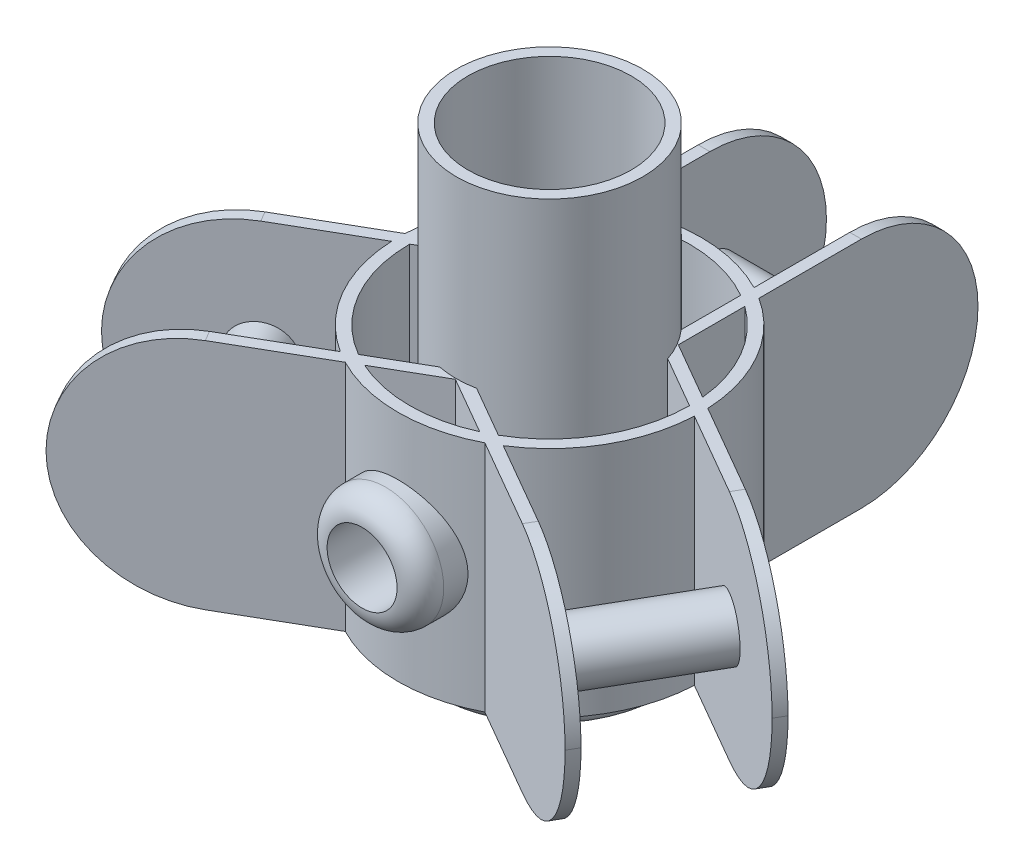
from build123d import *
from build123d.topology import SkipClean

# Parameters (mm, degrees)
SKETCH1_R                = 7
BOSS_EXTRUDE1_DEPTH      = 20
FILLET1_R                = 10
SKETCH2_R                = 13
BOSS_EXTRUDE2_DEPTH      = 1
SKETCH3_R                = 8
SKETCH3_R_2              = 7
BOSS_EXTRUDE3_DEPTH      = 15
SKETCH4_R                = 2.5
BOSS_EXTRUDE4_DEPTH      = 12
CIRPATTERN1_COUNT        = 3
BOSS_EXTRUDE5_REACH      = 66.665
BOSS_EXTRUDE5_END_RADIUS = 13
SKETCH5_R                = 5
FILLET2_R                = 2
SKETCH6_R                = 3
CUT_EXTRUDE1_DEPTH       = 12
SKETCH7_R                = 10
SKETCH7_R_2              = 6
BOSS_EXTRUDE6_DEPTH      = 3
FILLET3_R                = 1
BOSS_EXTRUDE7_DEPTH      = 0.25
CUT_EXTRUDE2_START       = -10.25
SKETCH9_R                = 6
CUT_EXTRUDE2_DEPTH       = 10.25
FILLET4_R                = 1


with BuildPart() as part:
    # Sketch1 → Boss-Extrude1 (new body)
    with BuildSketch(Plane(origin=(0, 0, 0), x_dir=(1, 0, 0), z_dir=(0, 1, 0))):
        with BuildLine():
            Line((-6, 11.532562595), (-6, 29.746794345))
            Line((-6, 29.746794345), (-7, 29.746794345))
            Line((-7, 29.746794345), (-7, 10.95445115))
            ThreePointArc((-7, 10.95445115), (-11.258330249, 6.5), (-12.986832981, 0.584952251))
            Line((-12.986832981, 0.584952251), (-29.261479584, -8.811219346))
            Line((-29.261479584, -8.811219346), (-28.761479584, -9.67724475))
            Line((-28.761479584, -9.67724475), (-12.987492178, -0.570128875))
            ThreePointArc((-12.987492178, -0.570128875), (-11.258330249, -6.5), (-6.987492178, -10.96243372))
            Line((-6.987492178, -10.96243372), (-22.761479584, -20.069549595))
            Line((-22.761479584, -20.069549595), (-22.261479584, -20.935574999))
            Line((-22.261479584, -20.935574999), (-5.986832981, -11.539403402))
            ThreePointArc((-5.986832981, -11.539403402), (0, -13), (5.986832981, -11.539403402))
            Line((5.986832981, -11.539403402), (22.261479584, -20.935574999))
            Line((22.261479584, -20.935574999), (22.761479584, -20.069549595))
            Line((22.761479584, -20.069549595), (6.987492178, -10.96243372))
            ThreePointArc((6.987492178, -10.96243372), (11.258330249, -6.5), (12.987492178, -0.570128875))
            Line((12.987492178, -0.570128875), (28.761479584, -9.67724475))
            Line((28.761479584, -9.67724475), (29.261479584, -8.811219346))
            Line((29.261479584, -8.811219346), (12.986832981, 0.584952251))
            ThreePointArc((12.986832981, 0.584952251), (11.258330249, 6.5), (7, 10.95445115))
            Line((7, 10.95445115), (7, 29.746794345))
            Line((7, 29.746794345), (6, 29.746794345))
            Line((6, 29.746794345), (6, 11.532562595))
            ThreePointArc((6, 11.532562595), (0, 13), (-6, 11.532562595))
        make_face()
        with Locations(Location((0, 0, 0), (0, 0, 270))):
            Circle(SKETCH1_R, mode=Mode.SUBTRACT)
        with BuildLine():
            Line((-7, 4.041451884), (-7, 9.746794345))
            ThreePointArc((-7, 9.746794345), (-10.392304845, 6), (-11.940971508, 1.188780654))
            Line((-11.940971508, 1.188780654), (-7, 4.041451884))
        make_face(mode=Mode.SUBTRACT)
        with BuildLine():
            Line((6, 10.392304845), (6, 5.291502622))
            ThreePointArc((6, 5.291502622), (0, 8), (-6, 5.291502622))
            Line((-6, 5.291502622), (-6, 10.392304845))
            ThreePointArc((-6, 10.392304845), (0, 12), (6, 10.392304845))
        make_face(mode=Mode.SUBTRACT)
        with BuildLine():
            Line((7, 4.041451884), (7, 9.746794345))
            ThreePointArc((7, 9.746794345), (10.392304845, 6), (11.940971508, 1.188780654))
            Line((11.940971508, 1.188780654), (7, 4.041451884))
        make_face(mode=Mode.SUBTRACT)
        with BuildLine():
            Line((7.582575695, 2.550401112), (12, 0))
            ThreePointArc((12, 0), (10.392304845, -6), (6, -10.392304845))
            Line((6, -10.392304845), (1.582575695, -7.841903734))
            ThreePointArc((1.582575695, -7.841903734), (6.92820323, -4), (7.582575695, 2.550401112))
        make_face(mode=Mode.SUBTRACT)
        with BuildLine():
            Line((0, -8.082903769), (4.940971508, -10.935574999))
            ThreePointArc((4.940971508, -10.935574999), (0, -12), (-4.940971508, -10.935574999))
            Line((-4.940971508, -10.935574999), (0, -8.082903769))
        make_face(mode=Mode.SUBTRACT)
        with BuildLine():
            Line((-1.582575695, -7.841903734), (-6, -10.392304845))
            ThreePointArc((-6, -10.392304845), (-10.392304845, -6), (-12, 0))
            Line((-12, 0), (-7.582575695, 2.550401112))
            ThreePointArc((-7.582575695, 2.550401112), (-6.92820323, -4), (-1.582575695, -7.841903734))
        make_face(mode=Mode.SUBTRACT)
    extrude(amount=BOSS_EXTRUDE1_DEPTH)

    # Fillet1
    fillet1_edges = [part.edges().sort_by_distance(p)[0] for p in [
        (29.011479584, 20, 9.244232048),
        (29.011479584, 0, 9.244232048),
        (22.511479584, 0, 20.502562297),
        (22.511479584, 20, 20.502562297),
        (-29.011479584, 0, 9.244232048),
        (-22.511479584, 0, 20.502562297),
        (-22.511479584, 20, 20.502562297),
        (-29.011479584, 20, 9.244232048),
        (6.5, 0, -29.746794345),
        (6.5, 20, -29.746794345),
        (-6.5, 0, -29.746794345),
        (-6.5, 20, -29.746794345),
    ]]
    fillet(fillet1_edges, radius=FILLET1_R - 0.0001)  # a hair under: the kernel refuses the full size

    # Sketch2 → Boss-Extrude2 (add)
    with BuildSketch(Plane.XZ):
        Circle(SKETCH2_R)
    extrude(amount=-BOSS_EXTRUDE2_DEPTH)

    # Sketch3 → Boss-Extrude3 (add)
    with BuildSketch(Plane(origin=(0, 20, 0), x_dir=(1, 0, 0), z_dir=(0, 1, 0))):
        with Locations(Location((0, 0, 0), (0, 0, 41.409622109))):
            Circle(SKETCH3_R)
        with Locations(Location((0, 0, 0), (0, 0, 90))):
            Circle(SKETCH3_R_2, mode=Mode.SUBTRACT)
    extrude(amount=BOSS_EXTRUDE3_DEPTH)

    # Sketch4 → Boss-Extrude4 (add)
    with BuildSketch(Plane(origin=(-3, 0, -5.196152423), x_dir=(0.8660254037844383, 0, -0.5000000000000007), z_dir=(0.5000000000000007, 0, 0.8660254037844383))):
        with Locations(Location((-19.746794345, 10, 0), (0, 0, 180))):
            Circle(SKETCH4_R)
    boss_extrude4 = extrude(amount=BOSS_EXTRUDE4_DEPTH)

    # CirPattern1: Boss-Extrude4 ×3 about axis
    cirpattern1_axis = Axis((0, 0, 0), (0, 1, 0))
    for i in range(1, CIRPATTERN1_COUNT):
        add(boss_extrude4.rotate(cirpattern1_axis, i * 360 / CIRPATTERN1_COUNT))

    # Boss-Extrude5: up to this cylinder (the profile starts outside it)
    boss_extrude5_end = Plane(origin=(0, 10, 0), z_dir=(0, -1, 0)) * Cylinder(BOSS_EXTRUDE5_END_RADIUS, 160.33, mode=Mode.PRIVATE)
    # Sketch5 → Boss-Extrude5 (add, up to the surface)
    with BuildSketch(Plane(origin=(0, 0, 16.082903769), x_dir=(0, -1, 0), z_dir=(0, 0, -1)), mode=Mode.PRIVATE) as boss_extrude5_sk1:
        with Locations(Location((-10, 0, 0), (0, 0, 270))):
            Circle(SKETCH5_R)
    boss_extrude5_tool1 = extrude(boss_extrude5_sk1.sketch, amount=BOSS_EXTRUDE5_REACH, mode=Mode.PRIVATE) - boss_extrude5_end
    add(boss_extrude5_tool1.solids().sort_by_distance((0, 10, 16.082904))[0])

    # Fillet2
    fillet2_edges = [part.edges().sort_by_distance(p)[0] for p in [
        (-5, 10, 16.082903769),
    ]]
    fillet(fillet2_edges, radius=FILLET2_R)

    # Sketch6 → Cut-Extrude1 (cut)
    with BuildSketch(Plane.XY.offset(16.082903769)):
        with Locations((0, 10)):
            Circle(SKETCH6_R)
    extrude(amount=-CUT_EXTRUDE1_DEPTH, mode=Mode.SUBTRACT)

    # Sketch7 → Boss-Extrude6 (add)
    with BuildSketch(Plane.XZ):
        with Locations(Location((0, 0, 0), (0, 0, 90))):
            Circle(SKETCH7_R)
        with Locations(Location((0, 0, 0), (0, 0, 270))):
            Circle(SKETCH7_R_2, mode=Mode.SUBTRACT)
    extrude(amount=BOSS_EXTRUDE6_DEPTH)

    # Fillet3
    fillet3_edges = [part.edges().sort_by_distance(p)[0] for p in [
        (0, -3, -10),
    ]]
    fillet(fillet3_edges, radius=FILLET3_R)

    # Sketch8 → Boss-Extrude7 (add)
    with SkipClean():  # the faces are left unmerged after this step: merging them gives an invalid solid
        with BuildSketch(Plane.XZ.offset(3)):
            with BuildLine():
                Line((4.779920216, 6.410457758), (3.586576745, 4.810038176))
                ThreePointArc((3.586576745, 4.810038176), (3, 5.196152423), (2.372326881, 5.511085661))
                Line((2.372326881, 5.511085661), (3.16165916, 7.344761214))
                ThreePointArc((3.16165916, 7.344761214), (3.463465128, 7.621629346), (3.870916299, 7.580080009))
                Line((3.870916299, 7.580080009), (4.25, 7.361215932))
                Line((4.25, 7.361215932), (4.629083701, 7.142351855))
                ThreePointArc((4.629083701, 7.142351855), (4.868792068, 6.810263459), (4.779920216, 6.410457758))
            make_face()
            with BuildLine():
                Line((0, 8.5), (-0.437728154, 8.5))
                ThreePointArc((-0.437728154, 8.5), (-0.811365887, 8.332257196), (-0.934303456, 7.941579376))
                Line((-0.934303456, 7.941579376), (-0.701047485, 5.958903626))
                ThreePointArc((-0.701047485, 5.958903626), (0, 6), (0.701047485, 5.958903626))
                Line((0.701047485, 5.958903626), (0.934303456, 7.941579376))
                ThreePointArc((0.934303456, 7.941579376), (0.811365887, 8.332257196), (0.437728154, 8.5))
                Line((0.437728154, 8.5), (0, 8.5))
            make_face()
            with BuildLine():
                Line((7.344761214, 3.16165916), (5.511085661, 2.372326881))
                ThreePointArc((5.511085661, 2.372326881), (5.196152423, 3), (4.810038176, 3.586576745))
                Line((4.810038176, 3.586576745), (6.410457758, 4.779920216))
                ThreePointArc((6.410457758, 4.779920216), (6.810263459, 4.868792068), (7.142351855, 4.629083701))
                Line((7.142351855, 4.629083701), (7.361215932, 4.25))
                Line((7.361215932, 4.25), (7.580080009, 3.870916299))
                ThreePointArc((7.580080009, 3.870916299), (7.621629346, 3.463465128), (7.344761214, 3.16165916))
            make_face()
            with BuildLine():
                Line((7.941579376, -0.934303456), (5.958903626, -0.701047485))
                ThreePointArc((5.958903626, -0.701047485), (6, 0), (5.958903626, 0.701047485))
                Line((5.958903626, 0.701047485), (7.941579376, 0.934303456))
                ThreePointArc((7.941579376, 0.934303456), (8.332257196, 0.811365887), (8.5, 0.437728154))
                Line((8.5, 0.437728154), (8.5, 0))
                Line((8.5, 0), (8.5, -0.437728154))
                ThreePointArc((8.5, -0.437728154), (8.332257196, -0.811365887), (7.941579376, -0.934303456))
            make_face()
            with BuildLine():
                Line((6.410457758, -4.779920216), (4.810038176, -3.586576745))
                ThreePointArc((4.810038176, -3.586576745), (5.196152423, -3), (5.511085661, -2.372326881))
                Line((5.511085661, -2.372326881), (7.344761214, -3.16165916))
                ThreePointArc((7.344761214, -3.16165916), (7.621629346, -3.463465128), (7.580080009, -3.870916299))
                Line((7.580080009, -3.870916299), (7.361215932, -4.25))
                Line((7.361215932, -4.25), (7.142351855, -4.629083701))
                ThreePointArc((7.142351855, -4.629083701), (6.810263459, -4.868792068), (6.410457758, -4.779920216))
            make_face()
            with BuildLine():
                Line((3.16165916, -7.344761214), (2.372326881, -5.511085661))
                ThreePointArc((2.372326881, -5.511085661), (3, -5.196152423), (3.586576745, -4.810038176))
                Line((3.586576745, -4.810038176), (4.779920216, -6.410457758))
                ThreePointArc((4.779920216, -6.410457758), (4.868792068, -6.810263459), (4.629083701, -7.142351855))
                Line((4.629083701, -7.142351855), (4.25, -7.361215932))
                Line((4.25, -7.361215932), (3.870916299, -7.580080009))
                ThreePointArc((3.870916299, -7.580080009), (3.463465128, -7.621629346), (3.16165916, -7.344761214))
            make_face()
            with BuildLine():
                Line((-0.934303456, -7.941579376), (-0.701047485, -5.958903626))
                ThreePointArc((-0.701047485, -5.958903626), (0, -6), (0.701047485, -5.958903626))
                Line((0.701047485, -5.958903626), (0.934303456, -7.941579376))
                ThreePointArc((0.934303456, -7.941579376), (0.811365887, -8.332257196), (0.437728154, -8.5))
                Line((0.437728154, -8.5), (0, -8.5))
                Line((0, -8.5), (-0.437728154, -8.5))
                ThreePointArc((-0.437728154, -8.5), (-0.811365887, -8.332257196), (-0.934303456, -7.941579376))
            make_face()
            with BuildLine():
                Line((-4.779920216, -6.410457758), (-3.586576745, -4.810038176))
                ThreePointArc((-3.586576745, -4.810038176), (-3, -5.196152423), (-2.372326881, -5.511085661))
                Line((-2.372326881, -5.511085661), (-3.16165916, -7.344761214))
                ThreePointArc((-3.16165916, -7.344761214), (-3.463465128, -7.621629346), (-3.870916299, -7.580080009))
                Line((-3.870916299, -7.580080009), (-4.25, -7.361215932))
                Line((-4.25, -7.361215932), (-4.629083701, -7.142351855))
                ThreePointArc((-4.629083701, -7.142351855), (-4.868792068, -6.810263459), (-4.779920216, -6.410457758))
            make_face()
            with BuildLine():
                Line((-7.344761214, -3.16165916), (-5.511085661, -2.372326881))
                ThreePointArc((-5.511085661, -2.372326881), (-5.196152423, -3), (-4.810038176, -3.586576745))
                Line((-4.810038176, -3.586576745), (-6.410457758, -4.779920216))
                ThreePointArc((-6.410457758, -4.779920216), (-6.810263459, -4.868792068), (-7.142351855, -4.629083701))
                Line((-7.142351855, -4.629083701), (-7.361215932, -4.25))
                Line((-7.361215932, -4.25), (-7.580080009, -3.870916299))
                ThreePointArc((-7.580080009, -3.870916299), (-7.621629346, -3.463465128), (-7.344761214, -3.16165916))
            make_face()
            with BuildLine():
                Line((-7.941579376, 0.934303456), (-5.958903626, 0.701047485))
                ThreePointArc((-5.958903626, 0.701047485), (-6, 0), (-5.958903626, -0.701047485))
                Line((-5.958903626, -0.701047485), (-7.941579376, -0.934303456))
                ThreePointArc((-7.941579376, -0.934303456), (-8.332257196, -0.811365887), (-8.5, -0.437728154))
                Line((-8.5, -0.437728154), (-8.5, 0))
                Line((-8.5, 0), (-8.5, 0.437728154))
                ThreePointArc((-8.5, 0.437728154), (-8.332257196, 0.811365887), (-7.941579376, 0.934303456))
            make_face()
            with BuildLine():
                Line((-6.410457758, 4.779920216), (-4.810038176, 3.586576745))
                ThreePointArc((-4.810038176, 3.586576745), (-5.196152423, 3), (-5.511085661, 2.372326881))
                Line((-5.511085661, 2.372326881), (-7.344761214, 3.16165916))
                ThreePointArc((-7.344761214, 3.16165916), (-7.621629346, 3.463465128), (-7.580080009, 3.870916299))
                Line((-7.580080009, 3.870916299), (-7.361215932, 4.25))
                Line((-7.361215932, 4.25), (-7.142351855, 4.629083701))
                ThreePointArc((-7.142351855, 4.629083701), (-6.810263459, 4.868792068), (-6.410457758, 4.779920216))
            make_face()
            with BuildLine():
                Line((-3.16165916, 7.344761214), (-2.372326881, 5.511085661))
                ThreePointArc((-2.372326881, 5.511085661), (-3, 5.196152423), (-3.586576745, 4.810038176))
                Line((-3.586576745, 4.810038176), (-4.779920216, 6.410457758))
                ThreePointArc((-4.779920216, 6.410457758), (-4.868792068, 6.810263459), (-4.629083701, 7.142351855))
                Line((-4.629083701, 7.142351855), (-4.25, 7.361215932))
                Line((-4.25, 7.361215932), (-3.870916299, 7.580080009))
                ThreePointArc((-3.870916299, 7.580080009), (-3.463465128, 7.621629346), (-3.16165916, 7.344761214))
            make_face()
        extrude(amount=BOSS_EXTRUDE7_DEPTH)

    # Sketch9 → Cut-Extrude2 (cut)
    with SkipClean():  # the faces are left unmerged after this step: merging them gives an invalid solid
        with BuildSketch(Plane.XZ.offset(CUT_EXTRUDE2_START)):
            with Locations(Location((0, 0, 0), (0, 0, 83.290163192))):
                Circle(SKETCH9_R)
        extrude(amount=CUT_EXTRUDE2_DEPTH, mode=Mode.SUBTRACT)

    # Fillet4
    fillet4_edges = [part.edges().sort_by_distance(p)[0] for p in [
        (-0.701047485, 1, -5.958903626),
    ]]
    fillet(fillet4_edges, radius=FILLET4_R - 0.0001)  # a hair under: the kernel refuses the full size


solid = part.part
